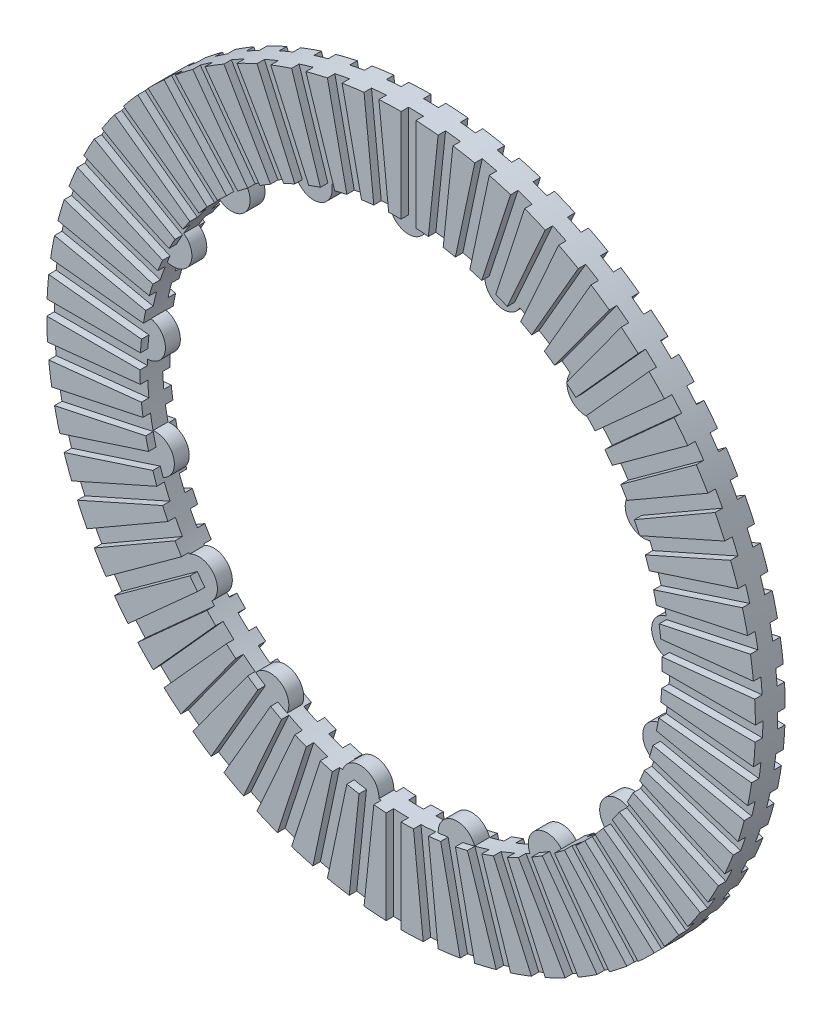
from build123d import *

# Parameters (mm, degrees)
SKETCH2_R                = 47.5
SKETCH2_R_2              = 35
BOSS_EXTRUDE1_DEPTH      = 4
SKETCH3_W                = 47.5
SKETCH3_H                = 2
CUT_EXTRUDE_THIN3_DEPTH  = 1
CIRPATTERN1_COUNT        = 60
MIRROR1_COPY_1_SKETCH_W  = 47.5
MIRROR1_COPY_1_SKETCH_H  = 2
MIRROR1_COPY_1_DEPTH     = 1
MIRROR1_COPY_2_SKETCH_W  = 47.5
MIRROR1_COPY_2_SKETCH_H  = 2
MIRROR1_COPY_2_DEPTH     = 1
MIRROR1_COPY_3_SKETCH_W  = 47.5
MIRROR1_COPY_3_SKETCH_H  = 2
MIRROR1_COPY_3_DEPTH     = 1
MIRROR1_COPY_4_SKETCH_W  = 47.5
MIRROR1_COPY_4_SKETCH_H  = 2
MIRROR1_COPY_4_DEPTH     = 1
MIRROR1_COPY_5_SKETCH_W  = 47.5
MIRROR1_COPY_5_SKETCH_H  = 2
MIRROR1_COPY_5_DEPTH     = 1
MIRROR1_COPY_6_SKETCH_W  = 47.5
MIRROR1_COPY_6_SKETCH_H  = 2
MIRROR1_COPY_6_DEPTH     = 1
MIRROR1_COPY_7_SKETCH_W  = 47.5
MIRROR1_COPY_7_SKETCH_H  = 2
MIRROR1_COPY_7_DEPTH     = 1
MIRROR1_COPY_8_SKETCH_W  = 47.5
MIRROR1_COPY_8_SKETCH_H  = 2
MIRROR1_COPY_8_DEPTH     = 1
MIRROR1_COPY_9_SKETCH_W  = 47.5
MIRROR1_COPY_9_SKETCH_H  = 2
MIRROR1_COPY_9_DEPTH     = 1
MIRROR1_COPY_10_SKETCH_W = 47.5
MIRROR1_COPY_10_SKETCH_H = 2
MIRROR1_COPY_10_DEPTH    = 1
MIRROR1_COPY_11_SKETCH_W = 47.5
MIRROR1_COPY_11_SKETCH_H = 2
MIRROR1_COPY_11_DEPTH    = 1
MIRROR1_COPY_12_SKETCH_W = 47.5
MIRROR1_COPY_12_SKETCH_H = 2
MIRROR1_COPY_12_DEPTH    = 1
MIRROR1_COPY_13_SKETCH_W = 47.5
MIRROR1_COPY_13_SKETCH_H = 2
MIRROR1_COPY_13_DEPTH    = 1
MIRROR1_COPY_14_SKETCH_W = 47.5
MIRROR1_COPY_14_SKETCH_H = 2
MIRROR1_COPY_14_DEPTH    = 1
MIRROR1_COPY_15_SKETCH_W = 47.5
MIRROR1_COPY_15_SKETCH_H = 2
MIRROR1_COPY_15_DEPTH    = 1
MIRROR1_COPY_16_SKETCH_W = 47.5
MIRROR1_COPY_16_SKETCH_H = 2
MIRROR1_COPY_16_DEPTH    = 1
MIRROR1_COPY_17_SKETCH_W = 47.5
MIRROR1_COPY_17_SKETCH_H = 2
MIRROR1_COPY_17_DEPTH    = 1
MIRROR1_COPY_18_SKETCH_W = 47.5
MIRROR1_COPY_18_SKETCH_H = 2
MIRROR1_COPY_18_DEPTH    = 1
MIRROR1_COPY_19_SKETCH_W = 47.5
MIRROR1_COPY_19_SKETCH_H = 2
MIRROR1_COPY_19_DEPTH    = 1
MIRROR1_COPY_20_SKETCH_W = 47.5
MIRROR1_COPY_20_SKETCH_H = 2
MIRROR1_COPY_20_DEPTH    = 1
MIRROR1_COPY_21_SKETCH_W = 47.5
MIRROR1_COPY_21_SKETCH_H = 2
MIRROR1_COPY_21_DEPTH    = 1
MIRROR1_COPY_22_SKETCH_W = 47.5
MIRROR1_COPY_22_SKETCH_H = 2
MIRROR1_COPY_22_DEPTH    = 1
MIRROR1_COPY_23_SKETCH_W = 47.5
MIRROR1_COPY_23_SKETCH_H = 2
MIRROR1_COPY_23_DEPTH    = 1
MIRROR1_COPY_24_SKETCH_W = 47.5
MIRROR1_COPY_24_SKETCH_H = 2
MIRROR1_COPY_24_DEPTH    = 1
MIRROR1_COPY_25_SKETCH_W = 47.5
MIRROR1_COPY_25_SKETCH_H = 2
MIRROR1_COPY_25_DEPTH    = 1
MIRROR1_COPY_26_SKETCH_W = 47.5
MIRROR1_COPY_26_SKETCH_H = 2
MIRROR1_COPY_26_DEPTH    = 1
MIRROR1_COPY_27_SKETCH_W = 47.5
MIRROR1_COPY_27_SKETCH_H = 2
MIRROR1_COPY_27_DEPTH    = 1
MIRROR1_COPY_28_SKETCH_W = 47.5
MIRROR1_COPY_28_SKETCH_H = 2
MIRROR1_COPY_28_DEPTH    = 1
MIRROR1_COPY_29_SKETCH_W = 47.5
MIRROR1_COPY_29_SKETCH_H = 2
MIRROR1_COPY_29_DEPTH    = 1
MIRROR1_COPY_30_SKETCH_W = 47.5
MIRROR1_COPY_30_SKETCH_H = 2
MIRROR1_COPY_30_DEPTH    = 1
MIRROR1_COPY_31_SKETCH_W = 47.5
MIRROR1_COPY_31_SKETCH_H = 2
MIRROR1_COPY_31_DEPTH    = 1
MIRROR1_COPY_32_SKETCH_W = 47.5
MIRROR1_COPY_32_SKETCH_H = 2
MIRROR1_COPY_32_DEPTH    = 1
MIRROR1_COPY_33_SKETCH_W = 47.5
MIRROR1_COPY_33_SKETCH_H = 2
MIRROR1_COPY_33_DEPTH    = 1
MIRROR1_COPY_34_SKETCH_W = 47.5
MIRROR1_COPY_34_SKETCH_H = 2
MIRROR1_COPY_34_DEPTH    = 1
MIRROR1_COPY_35_SKETCH_W = 47.5
MIRROR1_COPY_35_SKETCH_H = 2
MIRROR1_COPY_35_DEPTH    = 1
MIRROR1_COPY_36_SKETCH_W = 47.5
MIRROR1_COPY_36_SKETCH_H = 2
MIRROR1_COPY_36_DEPTH    = 1
MIRROR1_COPY_37_SKETCH_W = 47.5
MIRROR1_COPY_37_SKETCH_H = 2
MIRROR1_COPY_37_DEPTH    = 1
MIRROR1_COPY_38_SKETCH_W = 47.5
MIRROR1_COPY_38_SKETCH_H = 2
MIRROR1_COPY_38_DEPTH    = 1
MIRROR1_COPY_39_SKETCH_W = 47.5
MIRROR1_COPY_39_SKETCH_H = 2
MIRROR1_COPY_39_DEPTH    = 1
MIRROR1_COPY_40_SKETCH_W = 47.5
MIRROR1_COPY_40_SKETCH_H = 2
MIRROR1_COPY_40_DEPTH    = 1
MIRROR1_COPY_41_SKETCH_W = 47.5
MIRROR1_COPY_41_SKETCH_H = 2
MIRROR1_COPY_41_DEPTH    = 1
MIRROR1_COPY_42_SKETCH_W = 47.5
MIRROR1_COPY_42_SKETCH_H = 2
MIRROR1_COPY_42_DEPTH    = 1
MIRROR1_COPY_43_SKETCH_W = 47.5
MIRROR1_COPY_43_SKETCH_H = 2
MIRROR1_COPY_43_DEPTH    = 1
MIRROR1_COPY_44_SKETCH_W = 47.5
MIRROR1_COPY_44_SKETCH_H = 2
MIRROR1_COPY_44_DEPTH    = 1
MIRROR1_COPY_45_SKETCH_W = 47.5
MIRROR1_COPY_45_SKETCH_H = 2
MIRROR1_COPY_45_DEPTH    = 1
MIRROR1_COPY_46_SKETCH_W = 47.5
MIRROR1_COPY_46_SKETCH_H = 2
MIRROR1_COPY_46_DEPTH    = 1
MIRROR1_COPY_47_SKETCH_W = 47.5
MIRROR1_COPY_47_SKETCH_H = 2
MIRROR1_COPY_47_DEPTH    = 1
MIRROR1_COPY_48_SKETCH_W = 47.5
MIRROR1_COPY_48_SKETCH_H = 2
MIRROR1_COPY_48_DEPTH    = 1
MIRROR1_COPY_49_SKETCH_W = 47.5
MIRROR1_COPY_49_SKETCH_H = 2
MIRROR1_COPY_49_DEPTH    = 1
MIRROR1_COPY_50_SKETCH_W = 47.5
MIRROR1_COPY_50_SKETCH_H = 2
MIRROR1_COPY_50_DEPTH    = 1
MIRROR1_COPY_51_SKETCH_W = 47.5
MIRROR1_COPY_51_SKETCH_H = 2
MIRROR1_COPY_51_DEPTH    = 1
MIRROR1_COPY_52_SKETCH_W = 47.5
MIRROR1_COPY_52_SKETCH_H = 2
MIRROR1_COPY_52_DEPTH    = 1
MIRROR1_COPY_53_SKETCH_W = 47.5
MIRROR1_COPY_53_SKETCH_H = 2
MIRROR1_COPY_53_DEPTH    = 1
MIRROR1_COPY_54_SKETCH_W = 47.5
MIRROR1_COPY_54_SKETCH_H = 2
MIRROR1_COPY_54_DEPTH    = 1
MIRROR1_COPY_55_SKETCH_W = 47.5
MIRROR1_COPY_55_SKETCH_H = 2
MIRROR1_COPY_55_DEPTH    = 1
MIRROR1_COPY_56_SKETCH_W = 47.5
MIRROR1_COPY_56_SKETCH_H = 2
MIRROR1_COPY_56_DEPTH    = 1
MIRROR1_COPY_57_SKETCH_W = 47.5
MIRROR1_COPY_57_SKETCH_H = 2
MIRROR1_COPY_57_DEPTH    = 1
MIRROR1_COPY_58_SKETCH_W = 47.5
MIRROR1_COPY_58_SKETCH_H = 2
MIRROR1_COPY_58_DEPTH    = 1
MIRROR1_COPY_59_SKETCH_W = 47.5
MIRROR1_COPY_59_SKETCH_H = 2
MIRROR1_COPY_59_DEPTH    = 1
MIRROR1_COPY_60_SKETCH_W = 47.5
MIRROR1_COPY_60_SKETCH_H = 2
MIRROR1_COPY_60_DEPTH    = 1
BOSS_EXTRUDE2_DEPTH      = 1
BOSS_EXTRUDE2_DEPTH_BACK = 1
SKETCH4_R                = 2.5


with BuildPart() as part:
    # Sketch2 → Boss-Extrude1 (new body)
    with BuildSketch(Plane.XY):
        Circle(SKETCH2_R)
        Circle(SKETCH2_R_2, mode=Mode.SUBTRACT)
    extrude(amount=BOSS_EXTRUDE1_DEPTH)

    # Sketch3 → Cut-Extrude-Thin3 (cut, symmetric)
    with BuildSketch(Plane.XY.offset(4)):
        with Locations((23.75, -1)):
            Rectangle(SKETCH3_W, SKETCH3_H)
    cut_extrude_thin3 = extrude(amount=CUT_EXTRUDE_THIN3_DEPTH, both=True, mode=Mode.SUBTRACT)

    # CirPattern1: Cut-Extrude-Thin3 ×60 about axis
    cirpattern1_axis = Axis((0, 0, 4), (0, 0, 1))
    for i in range(1, CIRPATTERN1_COUNT):
        add(cut_extrude_thin3.rotate(cirpattern1_axis, i * 360 / CIRPATTERN1_COUNT), mode=Mode.SUBTRACT)

    # Mirror1 copy 1 sketch → Mirror1 copy 1 (cut, symmetric)
    with BuildSketch(Plane(origin=(0, 0, 0), x_dir=(0.9945218953682733, 0.10452846326765347, 0), z_dir=(0, 0, -1))):
        with Locations((23.75, 1)):
            Rectangle(MIRROR1_COPY_1_SKETCH_W, MIRROR1_COPY_1_SKETCH_H)
    extrude(amount=MIRROR1_COPY_1_DEPTH, both=True, mode=Mode.SUBTRACT)

    # Mirror1 copy 2 sketch → Mirror1 copy 2 (cut, symmetric)
    with BuildSketch(Plane(origin=(0, 0, 0), x_dir=(0.9781476007338057, 0.20791169081775934, 0), z_dir=(0, 0, -1))):
        with Locations((23.75, 1)):
            Rectangle(MIRROR1_COPY_2_SKETCH_W, MIRROR1_COPY_2_SKETCH_H)
    extrude(amount=MIRROR1_COPY_2_DEPTH, both=True, mode=Mode.SUBTRACT)

    # Mirror1 copy 3 sketch → Mirror1 copy 3 (cut, symmetric)
    with BuildSketch(Plane(origin=(0, 0, 0), x_dir=(0.9510565162951535, 0.3090169943749474, 0), z_dir=(0, 0, -1))):
        with Locations((23.75, 1)):
            Rectangle(MIRROR1_COPY_3_SKETCH_W, MIRROR1_COPY_3_SKETCH_H)
    extrude(amount=MIRROR1_COPY_3_DEPTH, both=True, mode=Mode.SUBTRACT)

    # Mirror1 copy 4 sketch → Mirror1 copy 4 (cut, symmetric)
    with BuildSketch(Plane(origin=(0, 0, 0), x_dir=(0.9135454576426009, 0.4067366430758002, 0), z_dir=(0, 0, -1))):
        with Locations((23.75, 1)):
            Rectangle(MIRROR1_COPY_4_SKETCH_W, MIRROR1_COPY_4_SKETCH_H)
    extrude(amount=MIRROR1_COPY_4_DEPTH, both=True, mode=Mode.SUBTRACT)

    # Mirror1 copy 5 sketch → Mirror1 copy 5 (cut, symmetric)
    with BuildSketch(Plane(origin=(0, 0, 0), x_dir=(0.8660254037844387, 0.49999999999999994, 0), z_dir=(0, 0, -1))):
        with Locations((23.75, 1)):
            Rectangle(MIRROR1_COPY_5_SKETCH_W, MIRROR1_COPY_5_SKETCH_H)
    extrude(amount=MIRROR1_COPY_5_DEPTH, both=True, mode=Mode.SUBTRACT)

    # Mirror1 copy 6 sketch → Mirror1 copy 6 (cut, symmetric)
    with BuildSketch(Plane(origin=(0, 0, 0), x_dir=(0.8090169943749475, 0.5877852522924731, 0), z_dir=(0, 0, -1))):
        with Locations((23.75, 1)):
            Rectangle(MIRROR1_COPY_6_SKETCH_W, MIRROR1_COPY_6_SKETCH_H)
    extrude(amount=MIRROR1_COPY_6_DEPTH, both=True, mode=Mode.SUBTRACT)

    # Mirror1 copy 7 sketch → Mirror1 copy 7 (cut, symmetric)
    with BuildSketch(Plane(origin=(0, 0, 0), x_dir=(0.7431448254773942, 0.6691306063588582, 0), z_dir=(0, 0, -1))):
        with Locations((23.75, 1)):
            Rectangle(MIRROR1_COPY_7_SKETCH_W, MIRROR1_COPY_7_SKETCH_H)
    extrude(amount=MIRROR1_COPY_7_DEPTH, both=True, mode=Mode.SUBTRACT)

    # Mirror1 copy 8 sketch → Mirror1 copy 8 (cut, symmetric)
    with BuildSketch(Plane(origin=(0, 0, 0), x_dir=(0.6691306063588582, 0.7431448254773942, 0), z_dir=(0, 0, -1))):
        with Locations((23.75, 1)):
            Rectangle(MIRROR1_COPY_8_SKETCH_W, MIRROR1_COPY_8_SKETCH_H)
    extrude(amount=MIRROR1_COPY_8_DEPTH, both=True, mode=Mode.SUBTRACT)

    # Mirror1 copy 9 sketch → Mirror1 copy 9 (cut, symmetric)
    with BuildSketch(Plane(origin=(0, 0, 0), x_dir=(0.5877852522924731, 0.8090169943749475, 0), z_dir=(0, 0, -1))):
        with Locations((23.75, 1)):
            Rectangle(MIRROR1_COPY_9_SKETCH_W, MIRROR1_COPY_9_SKETCH_H)
    extrude(amount=MIRROR1_COPY_9_DEPTH, both=True, mode=Mode.SUBTRACT)

    # Mirror1 copy 10 sketch → Mirror1 copy 10 (cut, symmetric)
    with BuildSketch(Plane(origin=(0, 0, 0), x_dir=(0.5000000000000001, 0.8660254037844386, 0), z_dir=(0, 0, -1))):
        with Locations((23.75, 1)):
            Rectangle(MIRROR1_COPY_10_SKETCH_W, MIRROR1_COPY_10_SKETCH_H)
    extrude(amount=MIRROR1_COPY_10_DEPTH, both=True, mode=Mode.SUBTRACT)

    # Mirror1 copy 11 sketch → Mirror1 copy 11 (cut, symmetric)
    with BuildSketch(Plane(origin=(0, 0, 0), x_dir=(0.4067366430758002, 0.9135454576426009, 0), z_dir=(0, 0, -1))):
        with Locations((23.75, 1)):
            Rectangle(MIRROR1_COPY_11_SKETCH_W, MIRROR1_COPY_11_SKETCH_H)
    extrude(amount=MIRROR1_COPY_11_DEPTH, both=True, mode=Mode.SUBTRACT)

    # Mirror1 copy 12 sketch → Mirror1 copy 12 (cut, symmetric)
    with BuildSketch(Plane(origin=(0, 0, 0), x_dir=(0.30901699437494745, 0.9510565162951535, 0), z_dir=(0, 0, -1))):
        with Locations((23.75, 1)):
            Rectangle(MIRROR1_COPY_12_SKETCH_W, MIRROR1_COPY_12_SKETCH_H)
    extrude(amount=MIRROR1_COPY_12_DEPTH, both=True, mode=Mode.SUBTRACT)

    # Mirror1 copy 13 sketch → Mirror1 copy 13 (cut, symmetric)
    with BuildSketch(Plane(origin=(0, 0, 0), x_dir=(0.20791169081775945, 0.9781476007338056, 0), z_dir=(0, 0, -1))):
        with Locations((23.75, 1)):
            Rectangle(MIRROR1_COPY_13_SKETCH_W, MIRROR1_COPY_13_SKETCH_H)
    extrude(amount=MIRROR1_COPY_13_DEPTH, both=True, mode=Mode.SUBTRACT)

    # Mirror1 copy 14 sketch → Mirror1 copy 14 (cut, symmetric)
    with BuildSketch(Plane(origin=(0, 0, 0), x_dir=(0.10452846326765346, 0.9945218953682733, 0), z_dir=(0, 0, -1))):
        with Locations((23.75, 1)):
            Rectangle(MIRROR1_COPY_14_SKETCH_W, MIRROR1_COPY_14_SKETCH_H)
    extrude(amount=MIRROR1_COPY_14_DEPTH, both=True, mode=Mode.SUBTRACT)

    # Mirror1 copy 15 sketch → Mirror1 copy 15 (cut, symmetric)
    with BuildSketch(Plane.YX):
        with Locations((23.75, 1)):
            Rectangle(MIRROR1_COPY_15_SKETCH_W, MIRROR1_COPY_15_SKETCH_H)
    extrude(amount=MIRROR1_COPY_15_DEPTH, both=True, mode=Mode.SUBTRACT)

    # Mirror1 copy 16 sketch → Mirror1 copy 16 (cut, symmetric)
    with BuildSketch(Plane(origin=(0, 0, 0), x_dir=(-0.10452846326765355, 0.9945218953682733, 0), z_dir=(0, 0, -1))):
        with Locations((23.75, 1)):
            Rectangle(MIRROR1_COPY_16_SKETCH_W, MIRROR1_COPY_16_SKETCH_H)
    extrude(amount=MIRROR1_COPY_16_DEPTH, both=True, mode=Mode.SUBTRACT)

    # Mirror1 copy 17 sketch → Mirror1 copy 17 (cut, symmetric)
    with BuildSketch(Plane(origin=(0, 0, 0), x_dir=(-0.20791169081775934, 0.9781476007338057, 0), z_dir=(0, 0, -1))):
        with Locations((23.75, 1)):
            Rectangle(MIRROR1_COPY_17_SKETCH_W, MIRROR1_COPY_17_SKETCH_H)
    extrude(amount=MIRROR1_COPY_17_DEPTH, both=True, mode=Mode.SUBTRACT)

    # Mirror1 copy 18 sketch → Mirror1 copy 18 (cut, symmetric)
    with BuildSketch(Plane(origin=(0, 0, 0), x_dir=(-0.30901699437494734, 0.9510565162951536, 0), z_dir=(0, 0, -1))):
        with Locations((23.75, 1)):
            Rectangle(MIRROR1_COPY_18_SKETCH_W, MIRROR1_COPY_18_SKETCH_H)
    extrude(amount=MIRROR1_COPY_18_DEPTH, both=True, mode=Mode.SUBTRACT)

    # Mirror1 copy 19 sketch → Mirror1 copy 19 (cut, symmetric)
    with BuildSketch(Plane(origin=(0, 0, 0), x_dir=(-0.40673664307580026, 0.9135454576426009, 0), z_dir=(0, 0, -1))):
        with Locations((23.75, 1)):
            Rectangle(MIRROR1_COPY_19_SKETCH_W, MIRROR1_COPY_19_SKETCH_H)
    extrude(amount=MIRROR1_COPY_19_DEPTH, both=True, mode=Mode.SUBTRACT)

    # Mirror1 copy 20 sketch → Mirror1 copy 20 (cut, symmetric)
    with BuildSketch(Plane(origin=(0, 0, 0), x_dir=(-0.4999999999999998, 0.8660254037844387, 0), z_dir=(0, 0, -1))):
        with Locations((23.75, 1)):
            Rectangle(MIRROR1_COPY_20_SKETCH_W, MIRROR1_COPY_20_SKETCH_H)
    extrude(amount=MIRROR1_COPY_20_DEPTH, both=True, mode=Mode.SUBTRACT)

    # Mirror1 copy 21 sketch → Mirror1 copy 21 (cut, symmetric)
    with BuildSketch(Plane(origin=(0, 0, 0), x_dir=(-0.587785252292473, 0.8090169943749475, 0), z_dir=(0, 0, -1))):
        with Locations((23.75, 1)):
            Rectangle(MIRROR1_COPY_21_SKETCH_W, MIRROR1_COPY_21_SKETCH_H)
    extrude(amount=MIRROR1_COPY_21_DEPTH, both=True, mode=Mode.SUBTRACT)

    # Mirror1 copy 22 sketch → Mirror1 copy 22 (cut, symmetric)
    with BuildSketch(Plane(origin=(0, 0, 0), x_dir=(-0.6691306063588582, 0.7431448254773942, 0), z_dir=(0, 0, -1))):
        with Locations((23.75, 1)):
            Rectangle(MIRROR1_COPY_22_SKETCH_W, MIRROR1_COPY_22_SKETCH_H)
    extrude(amount=MIRROR1_COPY_22_DEPTH, both=True, mode=Mode.SUBTRACT)

    # Mirror1 copy 23 sketch → Mirror1 copy 23 (cut, symmetric)
    with BuildSketch(Plane(origin=(0, 0, 0), x_dir=(-0.743144825477394, 0.6691306063588583, 0), z_dir=(0, 0, -1))):
        with Locations((23.75, 1)):
            Rectangle(MIRROR1_COPY_23_SKETCH_W, MIRROR1_COPY_23_SKETCH_H)
    extrude(amount=MIRROR1_COPY_23_DEPTH, both=True, mode=Mode.SUBTRACT)

    # Mirror1 copy 24 sketch → Mirror1 copy 24 (cut, symmetric)
    with BuildSketch(Plane(origin=(0, 0, 0), x_dir=(-0.8090169943749473, 0.5877852522924732, 0), z_dir=(0, 0, -1))):
        with Locations((23.75, 1)):
            Rectangle(MIRROR1_COPY_24_SKETCH_W, MIRROR1_COPY_24_SKETCH_H)
    extrude(amount=MIRROR1_COPY_24_DEPTH, both=True, mode=Mode.SUBTRACT)

    # Mirror1 copy 25 sketch → Mirror1 copy 25 (cut, symmetric)
    with BuildSketch(Plane(origin=(0, 0, 0), x_dir=(-0.8660254037844387, 0.49999999999999994, 0), z_dir=(0, 0, -1))):
        with Locations((23.75, 1)):
            Rectangle(MIRROR1_COPY_25_SKETCH_W, MIRROR1_COPY_25_SKETCH_H)
    extrude(amount=MIRROR1_COPY_25_DEPTH, both=True, mode=Mode.SUBTRACT)

    # Mirror1 copy 26 sketch → Mirror1 copy 26 (cut, symmetric)
    with BuildSketch(Plane(origin=(0, 0, 0), x_dir=(-0.9135454576426008, 0.40673664307580043, 0), z_dir=(0, 0, -1))):
        with Locations((23.75, 1)):
            Rectangle(MIRROR1_COPY_26_SKETCH_W, MIRROR1_COPY_26_SKETCH_H)
    extrude(amount=MIRROR1_COPY_26_DEPTH, both=True, mode=Mode.SUBTRACT)

    # Mirror1 copy 27 sketch → Mirror1 copy 27 (cut, symmetric)
    with BuildSketch(Plane(origin=(0, 0, 0), x_dir=(-0.9510565162951535, 0.3090169943749475, 0), z_dir=(0, 0, -1))):
        with Locations((23.75, 1)):
            Rectangle(MIRROR1_COPY_27_SKETCH_W, MIRROR1_COPY_27_SKETCH_H)
    extrude(amount=MIRROR1_COPY_27_DEPTH, both=True, mode=Mode.SUBTRACT)

    # Mirror1 copy 28 sketch → Mirror1 copy 28 (cut, symmetric)
    with BuildSketch(Plane(origin=(0, 0, 0), x_dir=(-0.9781476007338057, 0.20791169081775931, 0), z_dir=(0, 0, -1))):
        with Locations((23.75, 1)):
            Rectangle(MIRROR1_COPY_28_SKETCH_W, MIRROR1_COPY_28_SKETCH_H)
    extrude(amount=MIRROR1_COPY_28_DEPTH, both=True, mode=Mode.SUBTRACT)

    # Mirror1 copy 29 sketch → Mirror1 copy 29 (cut, symmetric)
    with BuildSketch(Plane(origin=(0, 0, 0), x_dir=(-0.9945218953682733, 0.10452846326765373, 0), z_dir=(0, 0, -1))):
        with Locations((23.75, 1)):
            Rectangle(MIRROR1_COPY_29_SKETCH_W, MIRROR1_COPY_29_SKETCH_H)
    extrude(amount=MIRROR1_COPY_29_DEPTH, both=True, mode=Mode.SUBTRACT)

    # Mirror1 copy 30 sketch → Mirror1 copy 30 (cut, symmetric)
    with BuildSketch(Plane(origin=(0, 0, 0), x_dir=(-1, 0, 0), z_dir=(0, 0, -1))):
        with Locations((23.75, 1)):
            Rectangle(MIRROR1_COPY_30_SKETCH_W, MIRROR1_COPY_30_SKETCH_H)
    extrude(amount=MIRROR1_COPY_30_DEPTH, both=True, mode=Mode.SUBTRACT)

    # Mirror1 copy 31 sketch → Mirror1 copy 31 (cut, symmetric)
    with BuildSketch(Plane(origin=(0, 0, 0), x_dir=(-0.9945218953682733, -0.1045284632676535, 0), z_dir=(0, 0, -1))):
        with Locations((23.75, 1)):
            Rectangle(MIRROR1_COPY_31_SKETCH_W, MIRROR1_COPY_31_SKETCH_H)
    extrude(amount=MIRROR1_COPY_31_DEPTH, both=True, mode=Mode.SUBTRACT)

    # Mirror1 copy 32 sketch → Mirror1 copy 32 (cut, symmetric)
    with BuildSketch(Plane(origin=(0, 0, 0), x_dir=(-0.9781476007338056, -0.2079116908177595, 0), z_dir=(0, 0, -1))):
        with Locations((23.75, 1)):
            Rectangle(MIRROR1_COPY_32_SKETCH_W, MIRROR1_COPY_32_SKETCH_H)
    extrude(amount=MIRROR1_COPY_32_DEPTH, both=True, mode=Mode.SUBTRACT)

    # Mirror1 copy 33 sketch → Mirror1 copy 33 (cut, symmetric)
    with BuildSketch(Plane(origin=(0, 0, 0), x_dir=(-0.9510565162951536, -0.3090169943749473, 0), z_dir=(0, 0, -1))):
        with Locations((23.75, 1)):
            Rectangle(MIRROR1_COPY_33_SKETCH_W, MIRROR1_COPY_33_SKETCH_H)
    extrude(amount=MIRROR1_COPY_33_DEPTH, both=True, mode=Mode.SUBTRACT)

    # Mirror1 copy 34 sketch → Mirror1 copy 34 (cut, symmetric)
    with BuildSketch(Plane(origin=(0, 0, 0), x_dir=(-0.9135454576426009, -0.4067366430758002, 0), z_dir=(0, 0, -1))):
        with Locations((23.75, 1)):
            Rectangle(MIRROR1_COPY_34_SKETCH_W, MIRROR1_COPY_34_SKETCH_H)
    extrude(amount=MIRROR1_COPY_34_DEPTH, both=True, mode=Mode.SUBTRACT)

    # Mirror1 copy 35 sketch → Mirror1 copy 35 (cut, symmetric)
    with BuildSketch(Plane(origin=(0, 0, 0), x_dir=(-0.8660254037844386, -0.5000000000000001, 0), z_dir=(0, 0, -1))):
        with Locations((23.75, 1)):
            Rectangle(MIRROR1_COPY_35_SKETCH_W, MIRROR1_COPY_35_SKETCH_H)
    extrude(amount=MIRROR1_COPY_35_DEPTH, both=True, mode=Mode.SUBTRACT)

    # Mirror1 copy 36 sketch → Mirror1 copy 36 (cut, symmetric)
    with BuildSketch(Plane(origin=(0, 0, 0), x_dir=(-0.8090169943749476, -0.587785252292473, 0), z_dir=(0, 0, -1))):
        with Locations((23.75, 1)):
            Rectangle(MIRROR1_COPY_36_SKETCH_W, MIRROR1_COPY_36_SKETCH_H)
    extrude(amount=MIRROR1_COPY_36_DEPTH, both=True, mode=Mode.SUBTRACT)

    # Mirror1 copy 37 sketch → Mirror1 copy 37 (cut, symmetric)
    with BuildSketch(Plane(origin=(0, 0, 0), x_dir=(-0.7431448254773942, -0.6691306063588582, 0), z_dir=(0, 0, -1))):
        with Locations((23.75, 1)):
            Rectangle(MIRROR1_COPY_37_SKETCH_W, MIRROR1_COPY_37_SKETCH_H)
    extrude(amount=MIRROR1_COPY_37_DEPTH, both=True, mode=Mode.SUBTRACT)

    # Mirror1 copy 38 sketch → Mirror1 copy 38 (cut, symmetric)
    with BuildSketch(Plane(origin=(0, 0, 0), x_dir=(-0.6691306063588581, -0.7431448254773944, 0), z_dir=(0, 0, -1))):
        with Locations((23.75, 1)):
            Rectangle(MIRROR1_COPY_38_SKETCH_W, MIRROR1_COPY_38_SKETCH_H)
    extrude(amount=MIRROR1_COPY_38_DEPTH, both=True, mode=Mode.SUBTRACT)

    # Mirror1 copy 39 sketch → Mirror1 copy 39 (cut, symmetric)
    with BuildSketch(Plane(origin=(0, 0, 0), x_dir=(-0.5877852522924732, -0.8090169943749473, 0), z_dir=(0, 0, -1))):
        with Locations((23.75, 1)):
            Rectangle(MIRROR1_COPY_39_SKETCH_W, MIRROR1_COPY_39_SKETCH_H)
    extrude(amount=MIRROR1_COPY_39_DEPTH, both=True, mode=Mode.SUBTRACT)

    # Mirror1 copy 40 sketch → Mirror1 copy 40 (cut, symmetric)
    with BuildSketch(Plane(origin=(0, 0, 0), x_dir=(-0.5000000000000004, -0.8660254037844384, 0), z_dir=(0, 0, -1))):
        with Locations((23.75, 1)):
            Rectangle(MIRROR1_COPY_40_SKETCH_W, MIRROR1_COPY_40_SKETCH_H)
    extrude(amount=MIRROR1_COPY_40_DEPTH, both=True, mode=Mode.SUBTRACT)

    # Mirror1 copy 41 sketch → Mirror1 copy 41 (cut, symmetric)
    with BuildSketch(Plane(origin=(0, 0, 0), x_dir=(-0.4067366430758001, -0.913545457642601, 0), z_dir=(0, 0, -1))):
        with Locations((23.75, 1)):
            Rectangle(MIRROR1_COPY_41_SKETCH_W, MIRROR1_COPY_41_SKETCH_H)
    extrude(amount=MIRROR1_COPY_41_DEPTH, both=True, mode=Mode.SUBTRACT)

    # Mirror1 copy 42 sketch → Mirror1 copy 42 (cut, symmetric)
    with BuildSketch(Plane(origin=(0, 0, 0), x_dir=(-0.30901699437494756, -0.9510565162951535, 0), z_dir=(0, 0, -1))):
        with Locations((23.75, 1)):
            Rectangle(MIRROR1_COPY_42_SKETCH_W, MIRROR1_COPY_42_SKETCH_H)
    extrude(amount=MIRROR1_COPY_42_DEPTH, both=True, mode=Mode.SUBTRACT)

    # Mirror1 copy 43 sketch → Mirror1 copy 43 (cut, symmetric)
    with BuildSketch(Plane(origin=(0, 0, 0), x_dir=(-0.2079116908177598, -0.9781476007338056, 0), z_dir=(0, 0, -1))):
        with Locations((23.75, 1)):
            Rectangle(MIRROR1_COPY_43_SKETCH_W, MIRROR1_COPY_43_SKETCH_H)
    extrude(amount=MIRROR1_COPY_43_DEPTH, both=True, mode=Mode.SUBTRACT)

    # Mirror1 copy 44 sketch → Mirror1 copy 44 (cut, symmetric)
    with BuildSketch(Plane(origin=(0, 0, 0), x_dir=(-0.10452846326765336, -0.9945218953682734, 0), z_dir=(0, 0, -1))):
        with Locations((23.75, 1)):
            Rectangle(MIRROR1_COPY_44_SKETCH_W, MIRROR1_COPY_44_SKETCH_H)
    extrude(amount=MIRROR1_COPY_44_DEPTH, both=True, mode=Mode.SUBTRACT)

    # Mirror1 copy 45 sketch → Mirror1 copy 45 (cut, symmetric)
    with BuildSketch(Plane(origin=(0, 0, 0), x_dir=(0, -1, 0), z_dir=(0, 0, -1))):
        with Locations((23.75, 1)):
            Rectangle(MIRROR1_COPY_45_SKETCH_W, MIRROR1_COPY_45_SKETCH_H)
    extrude(amount=MIRROR1_COPY_45_DEPTH, both=True, mode=Mode.SUBTRACT)

    # Mirror1 copy 46 sketch → Mirror1 copy 46 (cut, symmetric)
    with BuildSketch(Plane(origin=(0, 0, 0), x_dir=(0.10452846326765299, -0.9945218953682734, 0), z_dir=(0, 0, -1))):
        with Locations((23.75, 1)):
            Rectangle(MIRROR1_COPY_46_SKETCH_W, MIRROR1_COPY_46_SKETCH_H)
    extrude(amount=MIRROR1_COPY_46_DEPTH, both=True, mode=Mode.SUBTRACT)

    # Mirror1 copy 47 sketch → Mirror1 copy 47 (cut, symmetric)
    with BuildSketch(Plane(origin=(0, 0, 0), x_dir=(0.20791169081775943, -0.9781476007338056, 0), z_dir=(0, 0, -1))):
        with Locations((23.75, 1)):
            Rectangle(MIRROR1_COPY_47_SKETCH_W, MIRROR1_COPY_47_SKETCH_H)
    extrude(amount=MIRROR1_COPY_47_DEPTH, both=True, mode=Mode.SUBTRACT)

    # Mirror1 copy 48 sketch → Mirror1 copy 48 (cut, symmetric)
    with BuildSketch(Plane(origin=(0, 0, 0), x_dir=(0.30901699437494723, -0.9510565162951536, 0), z_dir=(0, 0, -1))):
        with Locations((23.75, 1)):
            Rectangle(MIRROR1_COPY_48_SKETCH_W, MIRROR1_COPY_48_SKETCH_H)
    extrude(amount=MIRROR1_COPY_48_DEPTH, both=True, mode=Mode.SUBTRACT)

    # Mirror1 copy 49 sketch → Mirror1 copy 49 (cut, symmetric)
    with BuildSketch(Plane(origin=(0, 0, 0), x_dir=(0.40673664307579976, -0.9135454576426011, 0), z_dir=(0, 0, -1))):
        with Locations((23.75, 1)):
            Rectangle(MIRROR1_COPY_49_SKETCH_W, MIRROR1_COPY_49_SKETCH_H)
    extrude(amount=MIRROR1_COPY_49_DEPTH, both=True, mode=Mode.SUBTRACT)

    # Mirror1 copy 50 sketch → Mirror1 copy 50 (cut, symmetric)
    with BuildSketch(Plane(origin=(0, 0, 0), x_dir=(0.5000000000000001, -0.8660254037844386, 0), z_dir=(0, 0, -1))):
        with Locations((23.75, 1)):
            Rectangle(MIRROR1_COPY_50_SKETCH_W, MIRROR1_COPY_50_SKETCH_H)
    extrude(amount=MIRROR1_COPY_50_DEPTH, both=True, mode=Mode.SUBTRACT)

    # Mirror1 copy 51 sketch → Mirror1 copy 51 (cut, symmetric)
    with BuildSketch(Plane(origin=(0, 0, 0), x_dir=(0.5877852522924729, -0.8090169943749476, 0), z_dir=(0, 0, -1))):
        with Locations((23.75, 1)):
            Rectangle(MIRROR1_COPY_51_SKETCH_W, MIRROR1_COPY_51_SKETCH_H)
    extrude(amount=MIRROR1_COPY_51_DEPTH, both=True, mode=Mode.SUBTRACT)

    # Mirror1 copy 52 sketch → Mirror1 copy 52 (cut, symmetric)
    with BuildSketch(Plane(origin=(0, 0, 0), x_dir=(0.6691306063588578, -0.7431448254773946, 0), z_dir=(0, 0, -1))):
        with Locations((23.75, 1)):
            Rectangle(MIRROR1_COPY_52_SKETCH_W, MIRROR1_COPY_52_SKETCH_H)
    extrude(amount=MIRROR1_COPY_52_DEPTH, both=True, mode=Mode.SUBTRACT)

    # Mirror1 copy 53 sketch → Mirror1 copy 53 (cut, symmetric)
    with BuildSketch(Plane(origin=(0, 0, 0), x_dir=(0.7431448254773942, -0.6691306063588581, 0), z_dir=(0, 0, -1))):
        with Locations((23.75, 1)):
            Rectangle(MIRROR1_COPY_53_SKETCH_W, MIRROR1_COPY_53_SKETCH_H)
    extrude(amount=MIRROR1_COPY_53_DEPTH, both=True, mode=Mode.SUBTRACT)

    # Mirror1 copy 54 sketch → Mirror1 copy 54 (cut, symmetric)
    with BuildSketch(Plane(origin=(0, 0, 0), x_dir=(0.8090169943749473, -0.5877852522924734, 0), z_dir=(0, 0, -1))):
        with Locations((23.75, 1)):
            Rectangle(MIRROR1_COPY_54_SKETCH_W, MIRROR1_COPY_54_SKETCH_H)
    extrude(amount=MIRROR1_COPY_54_DEPTH, both=True, mode=Mode.SUBTRACT)

    # Mirror1 copy 55 sketch → Mirror1 copy 55 (cut, symmetric)
    with BuildSketch(Plane(origin=(0, 0, 0), x_dir=(0.8660254037844384, -0.5000000000000004, 0), z_dir=(0, 0, -1))):
        with Locations((23.75, 1)):
            Rectangle(MIRROR1_COPY_55_SKETCH_W, MIRROR1_COPY_55_SKETCH_H)
    extrude(amount=MIRROR1_COPY_55_DEPTH, both=True, mode=Mode.SUBTRACT)

    # Mirror1 copy 56 sketch → Mirror1 copy 56 (cut, symmetric)
    with BuildSketch(Plane(origin=(0, 0, 0), x_dir=(0.913545457642601, -0.40673664307580015, 0), z_dir=(0, 0, -1))):
        with Locations((23.75, 1)):
            Rectangle(MIRROR1_COPY_56_SKETCH_W, MIRROR1_COPY_56_SKETCH_H)
    extrude(amount=MIRROR1_COPY_56_DEPTH, both=True, mode=Mode.SUBTRACT)

    # Mirror1 copy 57 sketch → Mirror1 copy 57 (cut, symmetric)
    with BuildSketch(Plane(origin=(0, 0, 0), x_dir=(0.9510565162951535, -0.3090169943749476, 0), z_dir=(0, 0, -1))):
        with Locations((23.75, 1)):
            Rectangle(MIRROR1_COPY_57_SKETCH_W, MIRROR1_COPY_57_SKETCH_H)
    extrude(amount=MIRROR1_COPY_57_DEPTH, both=True, mode=Mode.SUBTRACT)

    # Mirror1 copy 58 sketch → Mirror1 copy 58 (cut, symmetric)
    with BuildSketch(Plane(origin=(0, 0, 0), x_dir=(0.9781476007338056, -0.20791169081775987, 0), z_dir=(0, 0, -1))):
        with Locations((23.75, 1)):
            Rectangle(MIRROR1_COPY_58_SKETCH_W, MIRROR1_COPY_58_SKETCH_H)
    extrude(amount=MIRROR1_COPY_58_DEPTH, both=True, mode=Mode.SUBTRACT)

    # Mirror1 copy 59 sketch → Mirror1 copy 59 (cut, symmetric)
    with BuildSketch(Plane(origin=(0, 0, 0), x_dir=(0.9945218953682733, -0.10452846326765342, 0), z_dir=(0, 0, -1))):
        with Locations((23.75, 1)):
            Rectangle(MIRROR1_COPY_59_SKETCH_W, MIRROR1_COPY_59_SKETCH_H)
    extrude(amount=MIRROR1_COPY_59_DEPTH, both=True, mode=Mode.SUBTRACT)

    # Mirror1 copy 60 sketch → Mirror1 copy 60 (cut, symmetric)
    with BuildSketch(Plane(origin=(0, 0, 0), x_dir=(1, 0, 0), z_dir=(0, 0, -1))):
        with Locations((23.75, 1)):
            Rectangle(MIRROR1_COPY_60_SKETCH_W, MIRROR1_COPY_60_SKETCH_H)
    extrude(amount=MIRROR1_COPY_60_DEPTH, both=True, mode=Mode.SUBTRACT)

    # Sketch4 → Boss-Extrude2 (add, two sides: drawn at the far end of the back side and taken through both)
    with BuildSketch(Plane.XY.offset(2).offset(-BOSS_EXTRUDE2_DEPTH_BACK)):
        with Locations((0, 35.242964202)):
            Circle(SKETCH4_R)
        with Locations((12.73122711, 32.8630854)):
            Circle(SKETCH4_R)
        with Locations((23.743031452, 26.044864815)):
            Circle(SKETCH4_R)
        with Locations((31.548207832, 15.709140916)):
            Circle(SKETCH4_R)
        with Locations((35.09262393, 3.25181049)):
            Circle(SKETCH4_R)
        with Locations((33.897586711, -9.644694963)):
            Circle(SKETCH4_R)
        with Locations((28.124492574, -21.238630917)):
            Circle(SKETCH4_R)
        with Locations((18.553029871, -29.964172079)):
            Circle(SKETCH4_R)
        with Locations((6.475877679, -34.642885764)):
            Circle(SKETCH4_R)
        with Locations((-6.475877679, -34.642885764)):
            Circle(SKETCH4_R)
        with Locations((-18.553029871, -29.964172079)):
            Circle(SKETCH4_R)
        with Locations((-28.124492574, -21.238630917)):
            Circle(SKETCH4_R)
        with Locations((-33.897586711, -9.644694963)):
            Circle(SKETCH4_R)
        with Locations((-35.09262393, 3.25181049)):
            Circle(SKETCH4_R)
        with Locations((-31.548207832, 15.709140916)):
            Circle(SKETCH4_R)
        with Locations((-23.743031452, 26.044864815)):
            Circle(SKETCH4_R)
        with Locations((-12.73122711, 32.8630854)):
            Circle(SKETCH4_R)
    extrude(amount=BOSS_EXTRUDE2_DEPTH + BOSS_EXTRUDE2_DEPTH_BACK)


solid = part.part
